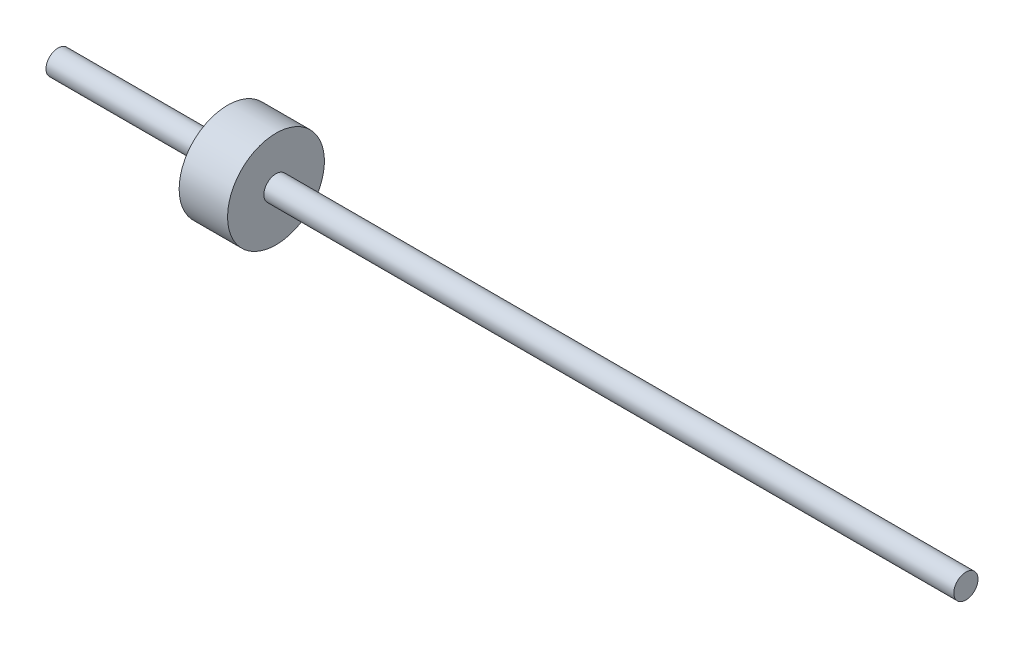
from build123d import *

# Parameters (mm, degrees)
SKETCH1_R               = 2
BOSS_EXTRUDE1_DEPTH     = 150
BOSS_EXTRUDE2_START     = 28
BOSS_EXTRUDE2_OUTLINE_R = 8
BOSS_EXTRUDE2_DEPTH     = 8


# Read off the part's stored shape, not the designer's step: Boss-Extrude2
with BuildPart() as part:
    # Sketch1 → Boss-Extrude1 (new body)
    with BuildSketch(Plane(origin=(0, 0, 0), x_dir=(0, 0, -1), z_dir=(1, 0, 0))):
        Circle(SKETCH1_R)
    extrude(amount=BOSS_EXTRUDE1_DEPTH)

    # Boss-Extrude2 outline → Boss-Extrude2 (add)
    with BuildSketch(Plane.YZ.offset(BOSS_EXTRUDE2_START)):
        with Locations((-0.186353815, 0)):
            Circle(BOSS_EXTRUDE2_OUTLINE_R)
    extrude(amount=BOSS_EXTRUDE2_DEPTH)


solid = part.part
